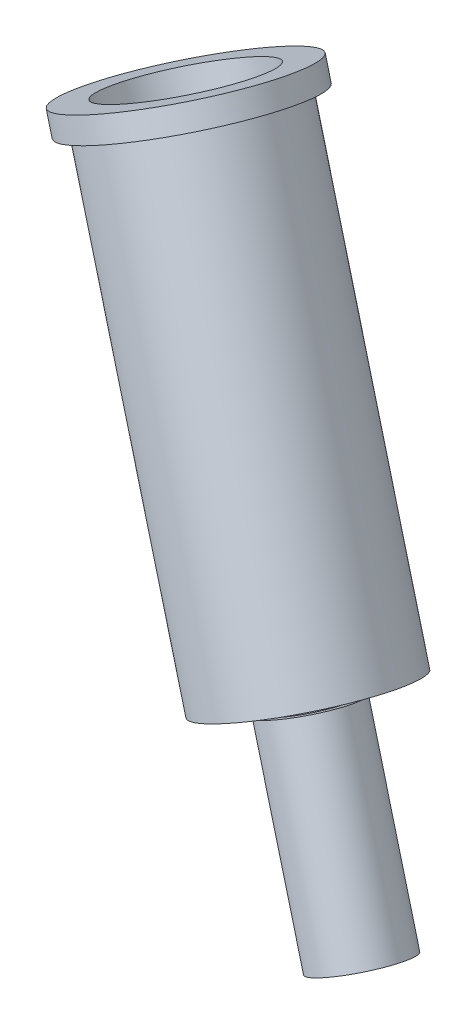
from build123d import *

# Parameters (mm, degrees)
SKETCH1_R           = 11.43
BOSS_EXTRUDE1_DEPTH = 2.54
SKETCH2_R           = 9.9949
BOSS_EXTRUDE2_DEPTH = 48.26
SKETCH3_R           = 3.81
BOSS_EXTRUDE3_DEPTH = 1.016
SKETCH4_R           = 4.7625
BOSS_EXTRUDE4_DEPTH = 21.336
SKETCH5_R           = 3.175
CUT_EXTRUDE1_DEPTH  = 96.465241051
SKETCH6_R           = 7.9375
CUT_EXTRUDE2_DEPTH  = 22.86


with BuildPart() as part:
    # Sketch1 → Boss-Extrude1 (new body)
    with BuildSketch(Plane(origin=(-129.203450499, 253.122013832, -50.271342949), x_dir=(0.8839119577418659, 0.40461078724322996, -0.23449895907520743), z_dir=(-0.4476862825736014, 0.8770605813697528, -0.1741887740435096))):
        with Locations((-31.085661697, -28.519102589)):
            Circle(SKETCH1_R)
    extrude(amount=BOSS_EXTRUDE1_DEPTH)

    # Sketch2 → Boss-Extrude2 (add)
    with BuildSketch(Plane(origin=(-129.203450499, 253.122013832, -50.271342949), x_dir=(-0.8839119577418658, -0.4046107872432301, 0.23449895907520704), z_dir=(0.44768628257360144, -0.8770605813697528, 0.17418877404350955))):
        with Locations((31.085661697, -28.519102589)):
            Circle(SKETCH2_R)
    extrude(amount=BOSS_EXTRUDE2_DEPTH)

    # Sketch3 → Boss-Extrude3 (add)
    with BuildSketch(Plane(origin=(-107.598110502, 210.795070175, -41.864992713), x_dir=(-0.8839119577418658, -0.40461078724323, 0.2344989590752073), z_dir=(0.44768628257360144, -0.8770605813697528, 0.17418877404350946))):
        with Locations((31.085661697, -28.519102589)):
            Circle(SKETCH3_R)
    extrude(amount=BOSS_EXTRUDE3_DEPTH)

    # Sketch4 → Boss-Extrude4 (add)
    with BuildSketch(Plane(origin=(-107.143261239, 209.903976624, -41.688016919), x_dir=(-0.8839119577418657, -0.40461078724322985, 0.23449895907520799), z_dir=(0.4476862825736014, -0.8770605813697527, 0.1741887740435095))):
        with Locations((31.085661697, -28.519102589)):
            Circle(SKETCH4_R)
    extrude(amount=BOSS_EXTRUDE4_DEPTH)

    # Sketch5 → Cut-Extrude1 (cut, through all)
    with BuildSketch(Plane(origin=(-130.340573657, 255.349747708, -50.713782435), x_dir=(0.8839119577418658, 0.40461078724323, -0.2344989590752073), z_dir=(-0.4476862825736014, 0.8770605813697528, -0.1741887740435095))):
        with Locations((-31.085661697, -28.519102589)):
            Circle(SKETCH5_R)
    extrude(amount=-CUT_EXTRUDE1_DEPTH, mode=Mode.SUBTRACT)

    # Sketch6 → Cut-Extrude2 (cut)
    with BuildSketch(Plane(origin=(-130.340573657, 255.349747708, -50.713782435), x_dir=(0.8839119577418658, 0.40461078724323, -0.2344989590752073), z_dir=(-0.4476862825736014, 0.8770605813697528, -0.1741887740435095))):
        with Locations((-31.085661697, -28.519102589)):
            Circle(SKETCH6_R)
    extrude(amount=-CUT_EXTRUDE2_DEPTH, mode=Mode.SUBTRACT)


solid = part.part
